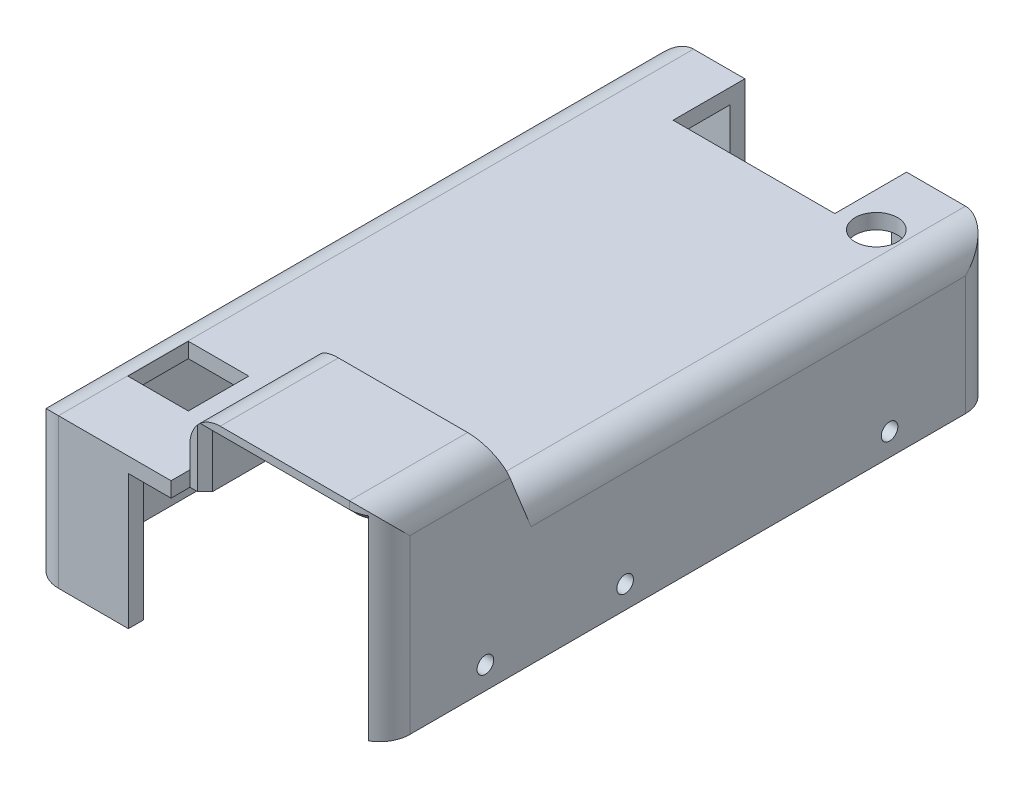
from build123d import *

# Parameters (mm, degrees)
SKETCH1_W               = 40
SKETCH1_H               = 94
BOSS_EXTRUDE1_DEPTH     = 2
SKETCH2_R               = 2.8
SKETCH2_W               = 21.4
SKETCH2_H               = 7.5
SKETCH2_W_2             = 8
SKETCH2_H_2             = 8
SKETCH2_W_3             = 21.1
SKETCH2_H_3             = 14.4
CUT_EXTRUDE1_DEPTH      = 52.117511677
BOSS_EXTRUDE2_DEPTH     = 21.1
BOSS_EXTRUDE3_DEPTH     = 2
SKETCH5_W               = 18.9
SKETCH5_H               = 4.55
BOSS_EXTRUDE5_DEPTH     = 2
SKETCH6_W               = 11.25
SKETCH6_H               = 19.79
BOSS_EXTRUDE6_DEPTH     = 2
SKETCH7_W               = 98.55
SKETCH7_H               = 19.79
BOSS_EXTRUDE7_DEPTH     = 2
SKETCH8_W               = 10.8
SKETCH8_H               = 19.79
SKETCH8_W_2             = 9.8
BOSS_EXTRUDE8_DEPTH     = 2
BOSS_EXTRUDE9_DEPTH     = 2
SKETCH12_R              = 1.1
CUT_EXTRUDE2_DEPTH      = 71.070582986
LPATTERN1_COUNT         = 3
LPATTERN1_PITCH         = 35
SKETCH13_W              = 25.1
SKETCH13_H              = 26.79
CUT_EXTRUDE3_DEPTH      = 2.5
FILLET1_R               = 4
FILLET2_R               = 5
CHAMFER1_SIZE           = 1
CUT_EXTRUDE4_DEPTH      = 0.5
CUT_EXTRUDE5_DEPTH      = 60.439436404
CUT_EXTRUDE5_DEPTH_BACK = 60.439436404
SKETCH15_W              = 44
SKETCH15_H              = 16.505


with BuildPart() as part:
    # Sketch1 → Boss-Extrude1 (new body)
    with BuildSketch(Plane(origin=(0, 0, 0), x_dir=(1, 0, 0), z_dir=(0, 1, 0))):
        Rectangle(SKETCH1_W, SKETCH1_H)
    extrude(amount=BOSS_EXTRUDE1_DEPTH)

    # Sketch2 → Cut-Extrude1 (cut, through all)
    with BuildSketch(Plane(origin=(0, 2, 0), x_dir=(1, 0, 0), z_dir=(0, 1, 0))):
        with Locations(Location((14.8, 40.4, 0), (0, 0, 270))):
            Circle(SKETCH2_R)
        with Locations((-0.5, 43.25)):
            Rectangle(SKETCH2_W, SKETCH2_H)
        with Locations((0.05, -20.02)):
            Rectangle(SKETCH2_W_2, SKETCH2_H_2)
        with Locations((14.05, -20.02)):
            Rectangle(SKETCH2_W_2, SKETCH2_H_2)
        with Locations((-13.95, -20.02)):
            Rectangle(SKETCH2_W_2, SKETCH2_H_2)
        with Locations((-13.95, -38.42)):
            Rectangle(SKETCH2_W_2, SKETCH2_H_2)
        with Locations((9.45, -39.8)):
            Rectangle(SKETCH2_W_3, SKETCH2_H_3)
    extrude(amount=-CUT_EXTRUDE1_DEPTH, mode=Mode.SUBTRACT)

    # Sketch3 → Boss-Extrude2 (add)
    with BuildSketch(Plane(origin=(20, 0, 0), x_dir=(0, 0, -1), z_dir=(1, 0, 0))):
        Polygon((-32.6, 2), (-34.6, 7), (-49.35, 7), (-49.35, 7.5), (-51.55, 7.5), (-51.55, 9), (-33.4, 9), (-30.6, 2), align=None)
    extrude(amount=-BOSS_EXTRUDE2_DEPTH)

    # Sketch4 → Boss-Extrude3 (add)
    with BuildSketch(Plane.ZY.offset(1.1)):
        Polygon((51.55, 9), (51.55, 2), (30.6, 2), (33.4, 9), align=None)
    extrude(amount=BOSS_EXTRUDE3_DEPTH)

    # Sketch5 → Boss-Extrude5 (add)
    with BuildSketch(Plane(origin=(0, 2, 0), x_dir=(1, 0, 0), z_dir=(0, 1, 0))):
        with Locations((-10.55, -49.275)):
            Rectangle(SKETCH5_W, SKETCH5_H)
    extrude(amount=-BOSS_EXTRUDE5_DEPTH)

    # Sketch6 → Boss-Extrude6 (add)
    with BuildSketch(Plane.XY.offset(51.55)):
        with Locations((-14.375, -7.895)):
            Rectangle(SKETCH6_W, SKETCH6_H)
    extrude(amount=-BOSS_EXTRUDE6_DEPTH)

    # Sketch7 → Boss-Extrude7 (add)
    with BuildSketch(Plane.ZY.offset(20)):
        with Locations((2.275, -7.895)):
            Rectangle(SKETCH7_W, SKETCH7_H)
    extrude(amount=BOSS_EXTRUDE7_DEPTH)

    # Sketch8 → Boss-Extrude8 (add)
    with BuildSketch(Plane(origin=(0, 0, -47), x_dir=(-1, 0, 0), z_dir=(0, 0, -1))):
        with Locations((16.6, -7.895)):
            Rectangle(SKETCH8_W, SKETCH8_H)
        with Locations((-15.1, -7.895)):
            Rectangle(SKETCH8_W_2, SKETCH8_H)
    extrude(amount=BOSS_EXTRUDE8_DEPTH)

    # Sketch9 → Boss-Extrude9 (add)
    with BuildSketch(Plane(origin=(20, 0, 0), x_dir=(0, 0, -1), z_dir=(1, 0, 0))):
        Polygon((-51.55, 9), (-51.55, -17.79), (49, -17.79), (49, 2), (-30.6, 2), (-33.4, 9), align=None)
    extrude(amount=BOSS_EXTRUDE9_DEPTH)

    # Sketch12 → Cut-Extrude2 (cut, symmetric)
    with BuildSketch(Plane(origin=(22, 0, 0), x_dir=(0, 0, -1), z_dir=(1, 0, 0))):
        with Locations((34.95, -14.79)):
            Circle(SKETCH12_R)
    cut_extrude2 = extrude(amount=CUT_EXTRUDE2_DEPTH, both=True, mode=Mode.SUBTRACT)

    # LPattern1: Cut-Extrude2 ×3
    with Locations(*[(0, 0, i * LPATTERN1_PITCH) for i in range(1, LPATTERN1_COUNT)]):
        add(cut_extrude2, mode=Mode.SUBTRACT)

    # Sketch13 → Cut-Extrude3 (cut)
    with BuildSketch(Plane.XY.offset(51.55)):
        with Locations((9.45, -4.395)):
            Rectangle(SKETCH13_W, SKETCH13_H)
    extrude(amount=-CUT_EXTRUDE3_DEPTH, mode=Mode.SUBTRACT)

    # Fillet1
    # the kernel refuses this fillet: 4 mm, written as the material it takes off along each edge
    with BuildSketch(Plane(origin=(22, -27.79, -49), x_dir=(-1, 0, 0), z_dir=(0, 1, 0))) as fillet1_piece_1:
        with BuildLine():
            CenterArc((FILLET1_R, FILLET1_R), FILLET1_R, 180, 90)
            Line((0, FILLET1_R), (0, 0))
            Line((0, 0), (FILLET1_R, 0))
        make_face()
    extrude(amount=39.79, mode=Mode.SUBTRACT)
    with BuildSketch(Plane(origin=(22, 9, 23.4), x_dir=(0, -1, 0), z_dir=(0, 0, 1))) as fillet1_piece_2:
        with BuildLine():
            CenterArc((FILLET1_R, -FILLET1_R), FILLET1_R, 90, 90)
            Line((0, -FILLET1_R), (0, 0))
            Line((0, 0), (FILLET1_R, 0))
        make_face()
    extrude(amount=35.65, mode=Mode.SUBTRACT)
    with BuildSketch(Plane(origin=(22, 2, -59), x_dir=(-1, 0, 0), z_dir=(0, 0, 1))) as fillet1_piece_3_section:
        with BuildLine():
            CenterArc((FILLET1_R, FILLET1_R), FILLET1_R, 180, 90)
            Line((0, FILLET1_R), (0, 0))
            Line((0, 0), (FILLET1_R, 0))
        make_face()
    fillet1_piece_3 = extrude(amount=99.6, mode=Mode.PRIVATE)
    fillet1_piece_3 = split(fillet1_piece_3, bisect_by=Plane(origin=(22, -28.896551724, 18.24137931), z_dir=(0, 0.3713906763541048, -0.928476690885259)), keep=Keep.TOP, mode=Mode.PRIVATE)
    add(fillet1_piece_3, mode=Mode.SUBTRACT)
    with BuildSketch(Plane(origin=(-22, -27.79, -49), x_dir=(1, 0, 0), z_dir=(0, 1, 0)), Plane(origin=(-22, 12, 51.55), x_dir=(1, 0, 0), z_dir=(0, -1, 0))) as fillet1_piece_4:
        with BuildLine():
            CenterArc((FILLET1_R, -FILLET1_R), FILLET1_R, 90, 90)
            Line((0, -FILLET1_R), (0, 0))
            Line((0, 0), (FILLET1_R, 0))
        make_face()
    extrude(amount=39.79, mode=Mode.SUBTRACT)
    with BuildSketch(Plane(origin=(-22, 2, -59), x_dir=(1, 0, 0), z_dir=(0, 0, 1))) as fillet1_piece_5:
        with BuildLine():
            CenterArc((FILLET1_R, -FILLET1_R), FILLET1_R, 90, 90)
            Line((0, -FILLET1_R), (0, 0))
            Line((0, 0), (FILLET1_R, 0))
        make_face()
    extrude(amount=120.55, mode=Mode.SUBTRACT)
    with BuildSketch(Plane(origin=(-3.1, 9, 23.4), x_dir=(0, -1, 0), z_dir=(0, 0, 1))) as fillet1_piece_6:
        with BuildLine():
            CenterArc((FILLET1_R, FILLET1_R), FILLET1_R, 180, 90)
            Line((0, FILLET1_R), (0, 0))
            Line((0, 0), (FILLET1_R, 0))
        make_face()
    extrude(amount=35.65, mode=Mode.SUBTRACT)
    with BuildSketch(Plane(origin=(22, -27.79, 49.05), x_dir=(-1, 0, 0), z_dir=(0, 1, 0))) as fillet1_piece_7:
        with BuildLine():
            CenterArc((FILLET1_R, -FILLET1_R), FILLET1_R, 90, 90)
            Line((0, -FILLET1_R), (0, 0))
            Line((0, 0), (FILLET1_R, 0))
        make_face()
    extrude(amount=46.79, mode=Mode.SUBTRACT)

    # Fillet2
    # the kernel refuses this fillet: 5 mm, written as the material it takes off along each edge
    with BuildSketch(Plane(origin=(20, 0, 32.6), x_dir=(0, 0, -1), z_dir=(-1, 0, 0))) as fillet2_piece_1:
        with BuildLine():
            CenterArc((4, -5), FILLET2_R, 90, 53.130102354)
            Line((0, -2), (0, 0))
            Line((0, 0), (4, 0))
        make_face()
    extrude(amount=21.1, mode=Mode.SUBTRACT)

    # Chamfer1
    # the kernel refuses this chamfer: 1 mm, written as the material it takes off along each edge
    with BuildSketch(Plane(origin=(-1.1, 7, 49.05), x_dir=(-1, 0, 0), z_dir=(0, -1, 0))) as chamfer1_piece_1:
        Polygon((CHAMFER1_SIZE, 0), (0, CHAMFER1_SIZE), (0, 0), align=None)
    extrude(amount=9.571682988, mode=Mode.SUBTRACT)
    with BuildSketch(Plane(origin=(-1.1, 7, 49.05), x_dir=(0, 1, 0), z_dir=(1, 0, 0))) as chamfer1_piece_2:
        Polygon((CHAMFER1_SIZE, 0), (0, -CHAMFER1_SIZE), (0, 0), align=None)
    extrude(amount=19.1, mode=Mode.SUBTRACT)
    with BuildSketch(Plane(origin=(18, 7, 45.05), x_dir=(0.919398394096703, 0, 0.3933275898438904), z_dir=(0.3933275898438904, 0, -0.919398394096703))) as chamfer1_piece_3_section:
        Polygon((4, -CHAMFER1_SIZE), (4 - CHAMFER1_SIZE, 0), (4, 0), align=None)
    chamfer1_piece_3 = revolve(axis=Axis((18, 7, 45.05), (0, -1, 0)), revolution_arc=66.838289129, mode=Mode.PRIVATE)
    chamfer1_piece_3 = split(chamfer1_piece_3, bisect_by=Plane(origin=(20, 7, 45.05), z_dir=(-1, 0, 0)), keep=Keep.TOP, mode=Mode.PRIVATE)
    add(chamfer1_piece_3, mode=Mode.SUBTRACT)
    with BuildSketch(Plane(origin=(-3.671682988, 7, 49.05), x_dir=(0, 1, 0), z_dir=(1, 0, 0))) as chamfer1_piece_4a_section:
        Polygon((CHAMFER1_SIZE, 0), (0, -CHAMFER1_SIZE), (0, 0), align=None)
    chamfer1_piece_4a = extrude(amount=21.671682988, mode=Mode.PRIVATE)
    chamfer1_piece_4a = split(chamfer1_piece_4a, bisect_by=Plane(origin=(-1.1, 7, 49.05), z_dir=(-1, 0, 0)), keep=Keep.TOP, mode=Mode.PRIVATE)
    with BuildSketch(Plane(origin=(-1.1, 9.571682988, 49.05), x_dir=(-1, 0, 0), z_dir=(0, -1, 0))) as chamfer1_piece_4b_section:
        Polygon((CHAMFER1_SIZE, 0), (0, CHAMFER1_SIZE), (0, 0), align=None)
    chamfer1_piece_4b = extrude(amount=12.143365976, mode=Mode.PRIVATE)
    chamfer1_piece_4b = split(chamfer1_piece_4b, bisect_by=Plane(origin=(-1.1, 7, 49.05), z_dir=(0, 1, 0)), keep=Keep.TOP, mode=Mode.PRIVATE)
    chamfer1_piece_4 = chamfer1_piece_4a & chamfer1_piece_4b
    add(chamfer1_piece_4, mode=Mode.SUBTRACT)

    # Sketch14 → Cut-Extrude4 (cut)
    with BuildSketch(Plane.ZY.offset(-20)):
        Polygon((47.286067977, 7), (34.6, 7), (32.6, 2), (32.6, -9.79), (47.286067977, -9.79), align=None)
    extrude(amount=-CUT_EXTRUDE4_DEPTH, mode=Mode.SUBTRACT)

    # Sketch15 → Cut-Extrude5 (cut, two sides: drawn at the far end of the back side and taken through both)
    with BuildSketch(Plane(origin=(0, 2, 0), x_dir=(1, 0, 0), z_dir=(0, 1, 0)).offset(-CUT_EXTRUDE5_DEPTH_BACK)):
        with Locations((0, -20.02)):
            Rectangle(SKETCH15_W, SKETCH15_H)
    extrude(amount=CUT_EXTRUDE5_DEPTH + CUT_EXTRUDE5_DEPTH_BACK, mode=Mode.SUBTRACT)


with BuildPart() as cut_extrude5_piece_1:
    # of the separate pieces the step leaves, piece 1, a body of its own (cut_extrude5_pieces)
    add(part.part.solids().sort_by_distance((-11.2, 2, -39.5))[0])


with BuildPart() as cut_extrude5_piece_2:
    # of the separate pieces the step leaves, piece 2, a body of its own (cut_extrude5_pieces)
    add(part.part.solids().sort_by_distance((-20, 0, 49.55))[0])


with BuildPart() as cut_extrude5_piece_2_1:
    # Body-Move/Copy1: read off the stored shape, not the designer's step
    # Body-Move/Copy1: moved
    add(cut_extrude5_piece_2.part.moved(Location((0, 0, -16.505))))

    # Combine1: union Cut-Extrude5 piece 1
    add(cut_extrude5_piece_1.part)


solid = cut_extrude5_piece_2_1.part
